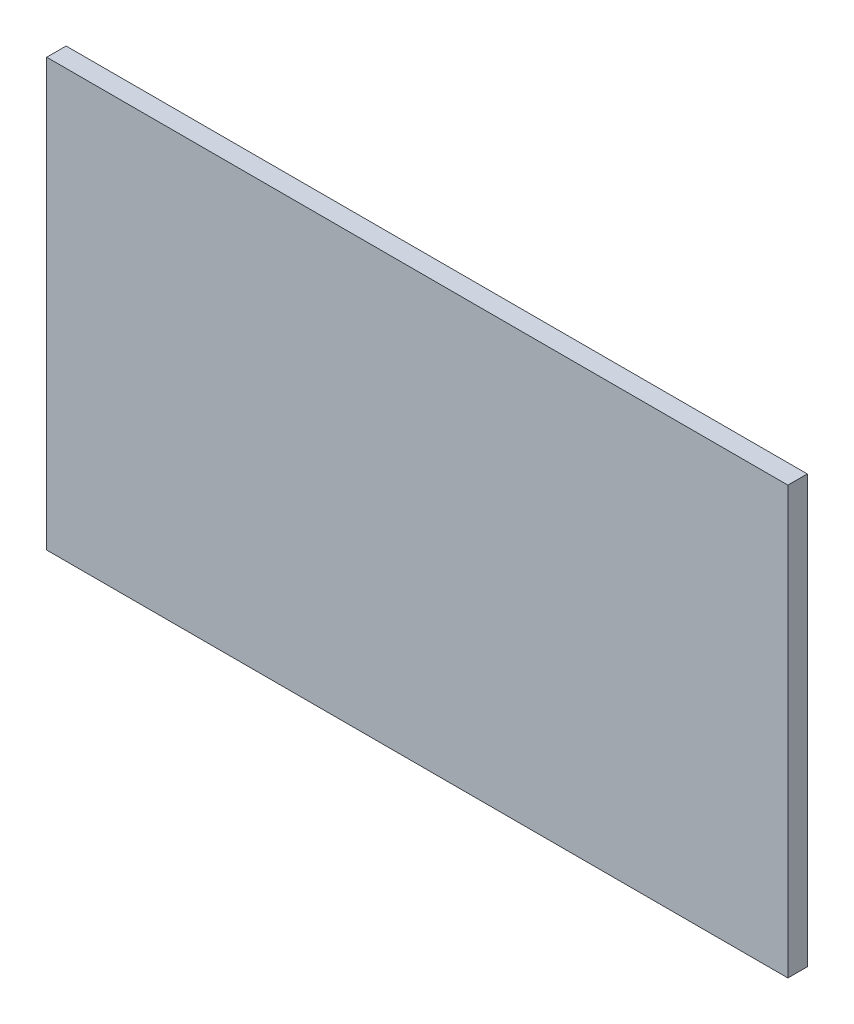
from build123d import *

# Parameters (mm, degrees)
SKETCH1_W           = 191
SKETCH1_H           = 110
BOSS_EXTRUDE1_DEPTH = 5


with BuildPart() as part:
    # Sketch1 → Boss-Extrude1 (new body)
    with BuildSketch(Plane.XY):
        Rectangle(SKETCH1_W, SKETCH1_H)
    extrude(amount=BOSS_EXTRUDE1_DEPTH)


solid = part.part
